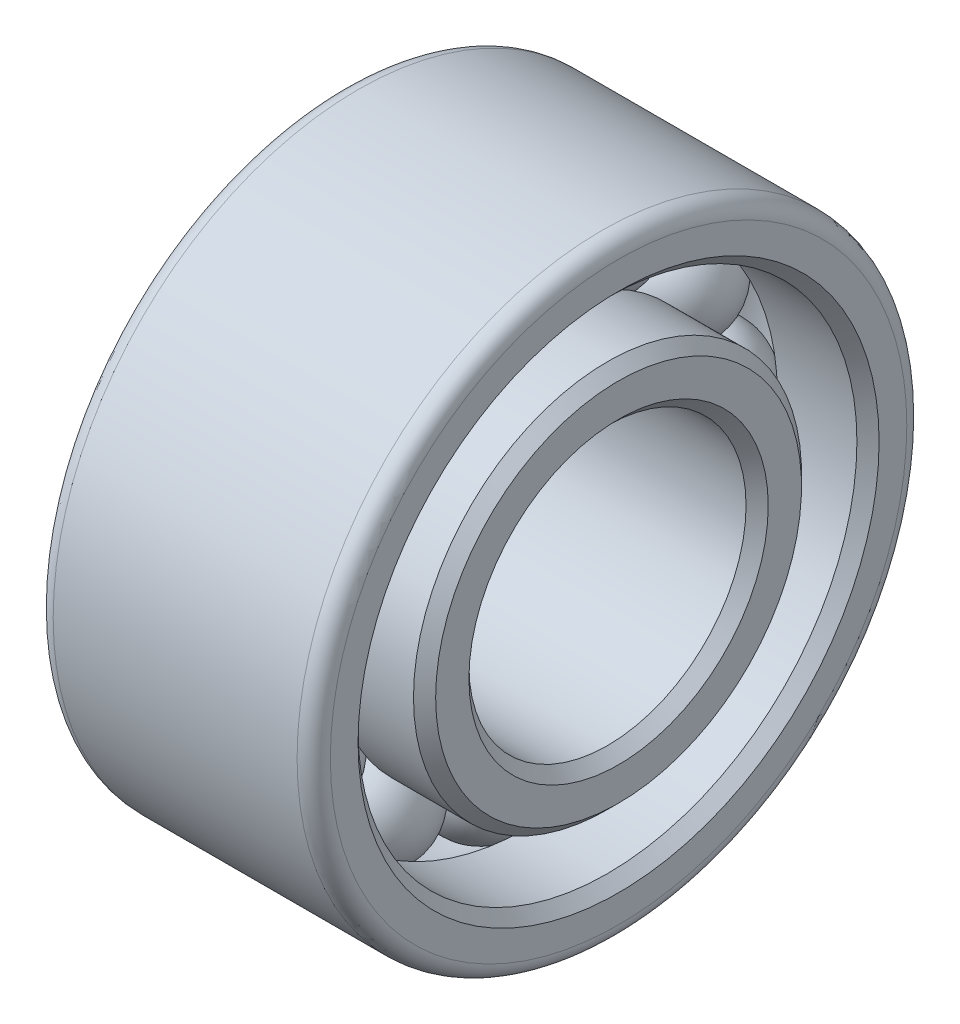
from build123d import *

# Parameters (mm, degrees)
PATTERN_CIRCULAR_5_COUNT = 12
FILLET_1_R               = 0.3
CHAMFER_1_SIZE           = 0.2
CHAMFER_2_SIZE           = 0.2
CHAMFER_3_SIZE           = 0.2


with BuildPart() as part:
    # Эскиз1 → Повернуть1 (revolve)
    with BuildSketch(Plane.XY):
        with BuildLine():
            Line((0, 0), (5, 0))
            Line((5, 0), (5, 1))
            Line((5, 1), (3.366025404, 1))
            ThreePointArc((3.366025404, 1), (2.5, 0.5), (1.633974596, 1))
            Line((1.633974596, 1), (0, 1))
            Line((0, 1), (0, 0))
        make_face()
        with BuildLine():
            Line((0, 2), (1.633974596, 2))
            ThreePointArc((1.633974596, 2), (2.5, 2.5), (3.366025404, 2))
            Line((3.366025404, 2), (5, 2))
            Line((5, 2), (5, 3))
            Line((5, 3), (0, 3))
            Line((0, 3), (0, 2))
        make_face()
    revolve(axis=Axis((-1.066901408, -2.5, 0), (1, 0, 0)))

    # Скругление1
    fillet_1_edges = [part.edges().sort_by_distance(p)[0] for p in [
        (5, -8, 0),
        (0, -8, 0),
    ]]
    fillet(fillet_1_edges, radius=FILLET_1_R)

    # Фаска1
    chamfer_1_edges = [part.edges().sort_by_distance(p)[0] for p in [
        (0, -5, 0),
        (5, -5, 0),
    ]]
    chamfer(chamfer_1_edges, length=CHAMFER_1_SIZE)

    # Фаска2
    chamfer_2_edges = [part.edges().sort_by_distance(p)[0] for p in [
        (5, -6, 0),
        (0, -6, 0),
    ]]
    chamfer(chamfer_2_edges, length=CHAMFER_2_SIZE)

    # Фаска3
    chamfer_3_edges = [part.edges().sort_by_distance(p)[0] for p in [
        (0, -7, 0),
        (5, -7, 0),
    ]]
    chamfer(chamfer_3_edges, length=CHAMFER_3_SIZE)


with BuildPart() as body_2:
    # Эскиз2 → Повернуть2 (revolve)
    with BuildSketch(Plane.XY):
        with BuildLine():
            Line((2.5, 2.5), (2.5, 0.5))
            ThreePointArc((2.5, 0.5), (1.5, 1.5), (2.5, 2.5))
        make_face()
    revolve(axis=Axis((2.5, 2.5, 0), (0, -1, 0)))


with BuildPart() as pattern_circular_5_1:
    # Круговой массив5: pattern copy
    add(body_2.part.rotate(Axis((0, -2.5, 0), (-1, 0, 0)), 1 * 360 / PATTERN_CIRCULAR_5_COUNT))


with BuildPart() as pattern_circular_5_2:
    # Круговой массив5: pattern copy
    add(body_2.part.rotate(Axis((0, -2.5, 0), (-1, 0, 0)), 2 * 360 / PATTERN_CIRCULAR_5_COUNT))


with BuildPart() as pattern_circular_5_3:
    # Круговой массив5: pattern copy
    add(body_2.part.rotate(Axis((0, -2.5, 0), (-1, 0, 0)), 3 * 360 / PATTERN_CIRCULAR_5_COUNT))


with BuildPart() as pattern_circular_5_4:
    # Круговой массив5: pattern copy
    add(body_2.part.rotate(Axis((0, -2.5, 0), (-1, 0, 0)), 4 * 360 / PATTERN_CIRCULAR_5_COUNT))


with BuildPart() as pattern_circular_5_5:
    # Круговой массив5: pattern copy
    add(body_2.part.rotate(Axis((0, -2.5, 0), (-1, 0, 0)), 5 * 360 / PATTERN_CIRCULAR_5_COUNT))


with BuildPart() as pattern_circular_5_6:
    # Круговой массив5: pattern copy
    add(body_2.part.rotate(Axis((0, -2.5, 0), (-1, 0, 0)), 6 * 360 / PATTERN_CIRCULAR_5_COUNT))


with BuildPart() as pattern_circular_5_7:
    # Круговой массив5: pattern copy
    add(body_2.part.rotate(Axis((0, -2.5, 0), (-1, 0, 0)), 7 * 360 / PATTERN_CIRCULAR_5_COUNT))


with BuildPart() as pattern_circular_5_8:
    # Круговой массив5: pattern copy
    add(body_2.part.rotate(Axis((0, -2.5, 0), (-1, 0, 0)), 8 * 360 / PATTERN_CIRCULAR_5_COUNT))


with BuildPart() as pattern_circular_5_9:
    # Круговой массив5: pattern copy
    add(body_2.part.rotate(Axis((0, -2.5, 0), (-1, 0, 0)), 9 * 360 / PATTERN_CIRCULAR_5_COUNT))


with BuildPart() as pattern_circular_5_10:
    # Круговой массив5: pattern copy
    add(body_2.part.rotate(Axis((0, -2.5, 0), (-1, 0, 0)), 10 * 360 / PATTERN_CIRCULAR_5_COUNT))


with BuildPart() as pattern_circular_5_11:
    # Круговой массив5: pattern copy
    add(body_2.part.rotate(Axis((0, -2.5, 0), (-1, 0, 0)), 11 * 360 / PATTERN_CIRCULAR_5_COUNT))


solid = Compound([part.part, body_2.part, pattern_circular_5_1.part, pattern_circular_5_2.part, pattern_circular_5_3.part, pattern_circular_5_4.part, pattern_circular_5_5.part, pattern_circular_5_6.part, pattern_circular_5_7.part, pattern_circular_5_8.part, pattern_circular_5_9.part, pattern_circular_5_10.part, pattern_circular_5_11.part])
